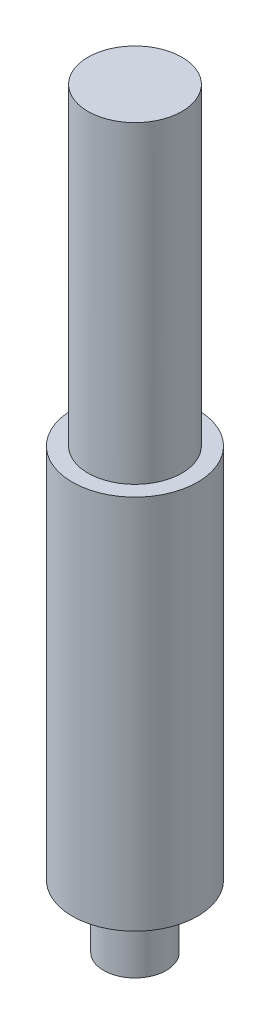
from build123d import *

# Parameters (mm, degrees)
SKETCH1_R           = 9.525
BOSS_EXTRUDE1_DEPTH = 63.5
SKETCH2_R           = 12.7
BOSS_EXTRUDE2_DEPTH = 76.2
SKETCH3_R           = 6.35
BOSS_EXTRUDE3_DEPTH = 12.7


with BuildPart() as part:
    # Sketch1 → Boss-Extrude1 (new body)
    with BuildSketch(Plane(origin=(0, 0, 0), x_dir=(1, 0, 0), z_dir=(0, 1, 0))):
        Circle(SKETCH1_R)
    extrude(amount=BOSS_EXTRUDE1_DEPTH)

    # Sketch2 → Boss-Extrude2 (add)
    with BuildSketch(Plane.XZ):
        Circle(SKETCH2_R)
    extrude(amount=BOSS_EXTRUDE2_DEPTH)

    # Sketch3 → Boss-Extrude3 (add)
    with BuildSketch(Plane.XZ.offset(76.2)):
        Circle(SKETCH3_R)
    extrude(amount=BOSS_EXTRUDE3_DEPTH)


solid = part.part
